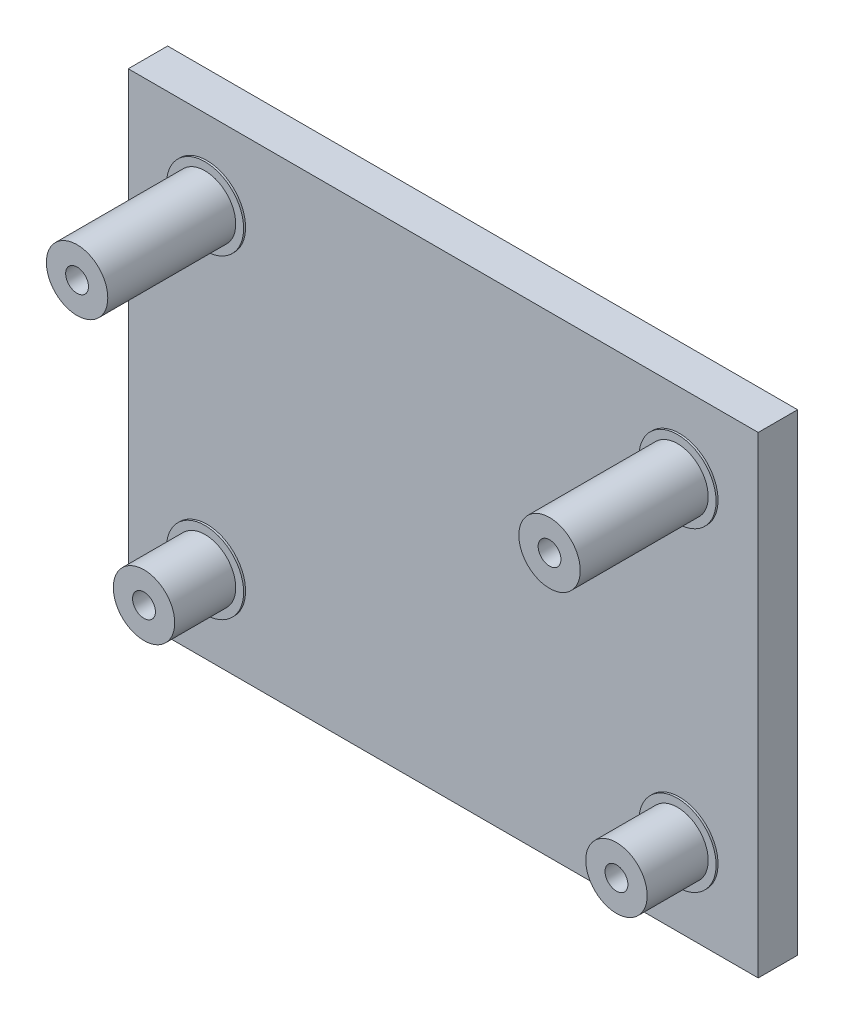
from build123d import *

# Parameters (mm, degrees)
SKETCH1_W           = 80
SKETCH1_H           = 60
BOSS_EXTRUDE1_DEPTH = 5
SKETCH1_3_R         = 3.9
SKETCH1_3_R_2       = 1.45
BOSS_EXTRUDE2_DEPTH = 8
SKETCH1_5_R         = 3.9
SKETCH1_5_R_2       = 1.45
BOSS_EXTRUDE4_DEPTH = 16.5
SKETCH1_4_R         = 4.9
SKETCH1_4_R_2       = 3.9
BOSS_EXTRUDE3_DEPTH = 0.25


with BuildPart() as part:
    # Sketch1 → Boss-Extrude1 (new body)
    with BuildSketch(Plane.XY):
        Rectangle(SKETCH1_W, SKETCH1_H)
    extrude(amount=-BOSS_EXTRUDE1_DEPTH)

    # Sketch1<3> → Boss-Extrude2 (add)
    # profile 1 of 2: a face of its own
    with BuildSketch(Plane.XY):
        with Locations((-30, -20)):
            Circle(SKETCH1_3_R)
        with Locations((-30, -20)):
            Circle(SKETCH1_3_R_2, mode=Mode.SUBTRACT)
    # profile 2 of 2: a face of its own
    with BuildSketch(Plane.XY):
        with Locations((30, -20)):
            Circle(SKETCH1_3_R)
        with Locations((30, -20)):
            Circle(SKETCH1_3_R_2, mode=Mode.SUBTRACT)
    extrude(amount=BOSS_EXTRUDE2_DEPTH)

    # Sketch1<5> → Boss-Extrude4 (add)
    # profile 1 of 2: a face of its own
    with BuildSketch(Plane.XY):
        with Locations((-30, 20)):
            Circle(SKETCH1_5_R)
        with Locations((-30, 20)):
            Circle(SKETCH1_5_R_2, mode=Mode.SUBTRACT)
    # profile 2 of 2: a face of its own
    with BuildSketch(Plane.XY):
        with Locations((30, 20)):
            Circle(SKETCH1_5_R)
        with Locations((30, 20)):
            Circle(SKETCH1_5_R_2, mode=Mode.SUBTRACT)
    extrude(amount=BOSS_EXTRUDE4_DEPTH)

    # Sketch1<4> → Boss-Extrude3 (add)
    # profile 1 of 4: a face of its own
    with BuildSketch(Plane.XY):
        with Locations((-30, 20)):
            Circle(SKETCH1_4_R)
        with Locations((-30, 20)):
            Circle(SKETCH1_4_R_2, mode=Mode.SUBTRACT)
    # profile 2 of 4: a face of its own
    with BuildSketch(Plane.XY):
        with Locations((30, 20)):
            Circle(SKETCH1_4_R)
        with Locations((30, 20)):
            Circle(SKETCH1_4_R_2, mode=Mode.SUBTRACT)
    # profile 3 of 4: a face of its own
    with BuildSketch(Plane.XY):
        with Locations((30, -20)):
            Circle(SKETCH1_4_R)
        with Locations((30, -20)):
            Circle(SKETCH1_4_R_2, mode=Mode.SUBTRACT)
    # profile 4 of 4: a face of its own
    with BuildSketch(Plane.XY):
        with Locations((-30, -20)):
            Circle(SKETCH1_4_R)
        with Locations((-30, -20)):
            Circle(SKETCH1_4_R_2, mode=Mode.SUBTRACT)
    extrude(amount=BOSS_EXTRUDE3_DEPTH)


solid = part.part
